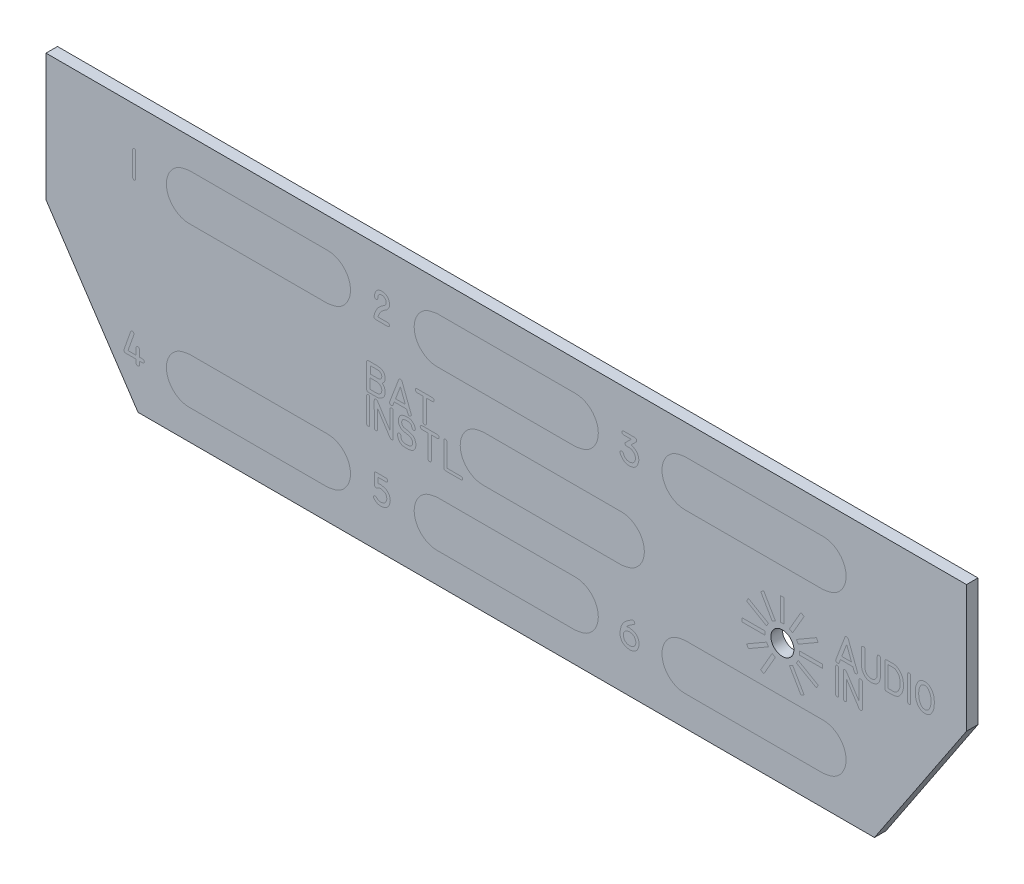
from build123d import *

# Parameters (mm, degrees)
BOSS_EXTRUDE1_DEPTH = 1.5875
CUT_EXTRUDE1_REACH  = 143.957
SKETCH3_R           = 1.5875


with BuildPart() as part:
    # Sketch1 → Boss-Extrude1 (new body)
    with BuildSketch(Plane.XY):
        Polygon((22.225, 2.286), (123.825, 2.286), (136.525, 21.336), (136.525, 38.862), (9.525, 38.862), (9.525, 21.336), align=None)
    extrude(amount=BOSS_EXTRUDE1_DEPTH)

    # Sketch3 → Cut-Extrude1 (cut, up to next)
    with BuildSketch(Plane.XY.offset(1.5875), mode=Mode.PRIVATE) as cut_extrude1_sk1:
        with Locations((111.125, 19.163404547)):
            Circle(SKETCH3_R)
    cut_extrude1_tool1 = extrude(cut_extrude1_sk1.sketch, amount=-CUT_EXTRUDE1_REACH, mode=Mode.PRIVATE) & part.part
    add(cut_extrude1_tool1.solids().sort_by_distance((111.125, 19.163405, 1.5875))[0], mode=Mode.SUBTRACT)


solid = part.part
